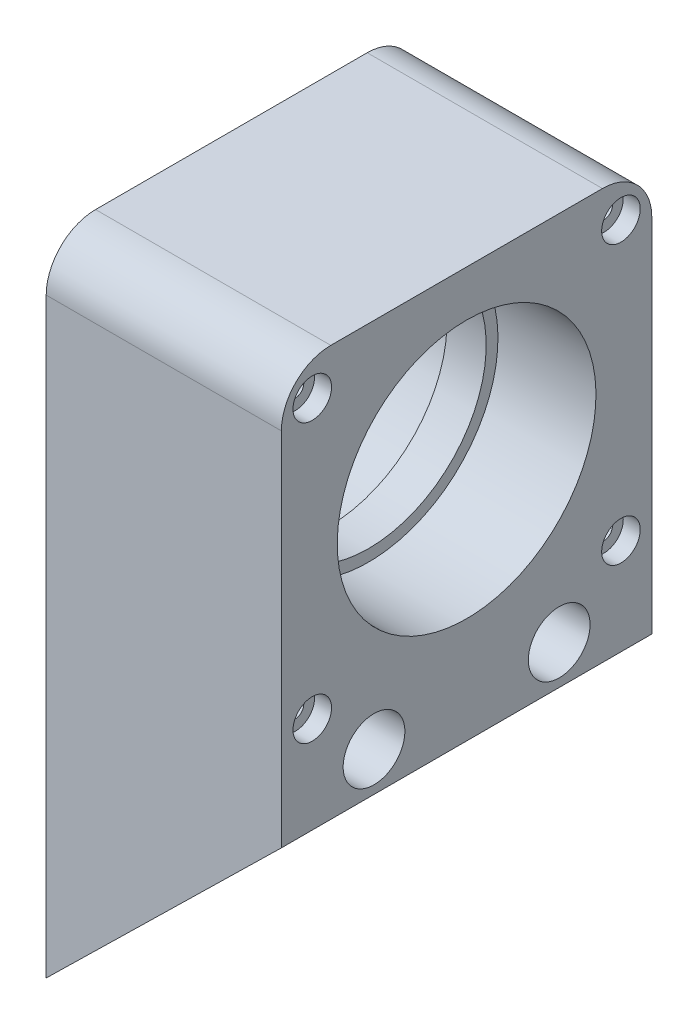
from build123d import *

# Parameters (mm, degrees)
BOSS_EXTRUDE1_DEPTH = 120
SKETCH3_R           = 4.25
CUT_EXTRUDE1_DEPTH  = 120
SKETCH5_R           = 10
CUT_EXTRUDE2_DEPTH  = 53
SKETCH6_R           = 4.25
CUT_EXTRUDE3_DEPTH  = 103
SKETCH7_W           = 76.2
SKETCH7_H           = 120
BOSS_EXTRUDE2_DEPTH = 101.6
SKETCH8_R           = 41.91
CUT_EXTRUDE4_DEPTH  = 31.75
CUT_EXTRUDE5_START  = -31.75
SKETCH9_R           = 41.91
CUT_EXTRUDE5_DEPTH  = 31.75
SKETCH10_R          = 38.1
CUT_EXTRUDE6_DEPTH  = 76.2
SKETCH13_W          = 76.2
SKETCH13_H          = 120
BOSS_EXTRUDE3_DEPTH = 6
SKETCH11_R          = 2.75
CUT_EXTRUDE7_DEPTH  = 84.4
SKETCH12_R          = 6.25
CUT_EXTRUDE8_DEPTH  = 5.5
FILLET1_R           = 16


with BuildPart() as part:
    # Sketch1 → Boss-Extrude1 (new body)
    with BuildSketch(Plane.XY):
        Polygon((381, 457.2), (457.2, 457.2), (457.2, 431.8), (381, 357.2), align=None)
    extrude(amount=BOSS_EXTRUDE1_DEPTH)

    # Sketch3 → Cut-Extrude1 (cut)
    with BuildSketch(Plane(origin=(457.2, 0, 0), x_dir=(0, 0, -1), z_dir=(1, 0, 0))):
        with Locations((-90, 394.5)):
            Circle(SKETCH3_R)
        with Locations((-30, 394.5)):
            Circle(SKETCH3_R)
    extrude(amount=-CUT_EXTRUDE1_DEPTH, mode=Mode.SUBTRACT)

    # Sketch5 → Cut-Extrude2 (cut)
    with BuildSketch(Plane(origin=(457.2, 0, 0), x_dir=(0, 0, -1), z_dir=(1, 0, 0))):
        with Locations((-90, 394.5)):
            Circle(SKETCH5_R)
        with Locations((-30, 394.5)):
            Circle(SKETCH5_R)
        with Locations((-90, 444.5)):
            Circle(SKETCH5_R)
        with Locations((-30, 444.5)):
            Circle(SKETCH5_R)
    extrude(amount=-CUT_EXTRUDE2_DEPTH, mode=Mode.SUBTRACT)

    # Sketch6 → Cut-Extrude3 (cut)
    with BuildSketch(Plane(origin=(457.2, 0, 0), x_dir=(0, 0, -1), z_dir=(1, 0, 0))):
        with Locations((-90, 444.5)):
            Circle(SKETCH6_R)
        with Locations((-30, 444.5)):
            Circle(SKETCH6_R)
    extrude(amount=-CUT_EXTRUDE3_DEPTH, mode=Mode.SUBTRACT)

    # Sketch7 → Boss-Extrude2 (add)
    with BuildSketch(Plane(origin=(0, 457.2, 0), x_dir=(1, 0, 0), z_dir=(0, 1, 0))):
        with Locations((419.1, -60)):
            Rectangle(SKETCH7_W, SKETCH7_H)
    extrude(amount=BOSS_EXTRUDE2_DEPTH)

    # Sketch8 → Cut-Extrude4 (cut)
    with BuildSketch(Plane.ZY.offset(-381)):
        with Locations((60, 508)):
            Circle(SKETCH8_R)
    extrude(amount=-CUT_EXTRUDE4_DEPTH, mode=Mode.SUBTRACT)

    # Sketch9 → Cut-Extrude5 (cut)
    with BuildSketch(Plane(origin=(457.2, 0, 0), x_dir=(0, 0, -1), z_dir=(1, 0, 0)).offset(CUT_EXTRUDE5_START)):
        with Locations((-60, 508)):
            Circle(SKETCH9_R)
    extrude(amount=CUT_EXTRUDE5_DEPTH, mode=Mode.SUBTRACT)

    # Sketch10 → Cut-Extrude6 (cut)
    with BuildSketch(Plane(origin=(457.2, 0, 0), x_dir=(0, 0, -1), z_dir=(1, 0, 0))):
        with Locations((-60, 508)):
            Circle(SKETCH10_R)
    extrude(amount=-CUT_EXTRUDE6_DEPTH, mode=Mode.SUBTRACT)

    # Sketch13 → Boss-Extrude3 (add)
    with BuildSketch(Plane(origin=(0, 558.8, 0), x_dir=(1, 0, 0), z_dir=(0, 1, 0))):
        with Locations((419.1, -60)):
            Rectangle(SKETCH13_W, SKETCH13_H)
    extrude(amount=BOSS_EXTRUDE3_DEPTH)

    # Sketch11 → Cut-Extrude7 (cut)
    with BuildSketch(Plane(origin=(457.2, 0, 0), x_dir=(0, 0, -1), z_dir=(1, 0, 0))):
        with Locations((-110, 553)):
            Circle(SKETCH11_R)
        with Locations((-10, 553)):
            Circle(SKETCH11_R)
        with Locations((-110, 463)):
            Circle(SKETCH11_R)
        with Locations((-10, 463)):
            Circle(SKETCH11_R)
    extrude(amount=-CUT_EXTRUDE7_DEPTH, mode=Mode.SUBTRACT)

    # Sketch12 → Cut-Extrude8 (cut)
    with BuildSketch(Plane(origin=(457.2, 0, 0), x_dir=(0, 0, -1), z_dir=(1, 0, 0))):
        with Locations((-110, 553)):
            Circle(SKETCH12_R)
        with Locations((-10, 553)):
            Circle(SKETCH12_R)
        with Locations((-10, 463)):
            Circle(SKETCH12_R)
        with Locations((-110, 463)):
            Circle(SKETCH12_R)
    extrude(amount=-CUT_EXTRUDE8_DEPTH, mode=Mode.SUBTRACT)

    # Fillet1
    fillet1_edges = [part.edges().sort_by_distance(p)[0] for p in [
        (419.1, 564.8, 0),
        (419.1, 564.8, 120),
    ]]
    fillet(fillet1_edges, radius=FILLET1_R)


solid = part.part
